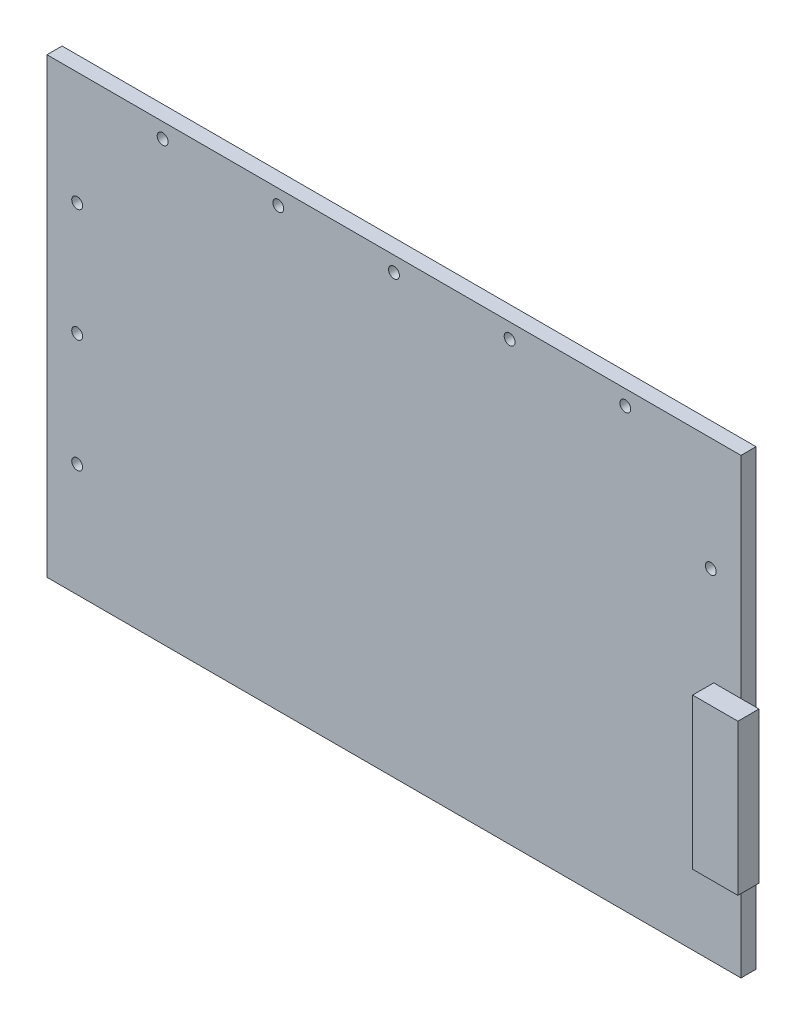
from build123d import *

# Parameters (mm, degrees)
SZKIC1_W                                          = 230
SZKIC1_H                                          = 150
DODANIE_WYCI_GNI_CIE1_DEPTH                       = 5
POG_BIENIE_WALCOWE_POD_M3_RUB_Z_BEM_S_D           = 3.6
POG_BIENIE_WALCOWE_POD_M3_RUB_Z_BEM_S_DEPTH       = 6.7
POG_BIENIE_WALCOWE_POD_M3_RUB_Z_BEM_S_CBORE_D     = 7
POG_BIENIE_WALCOWE_POD_M3_RUB_Z_BEM_S_CBORE_DEPTH = 2.4
POG_BIENIE_WALCOWE_POD_M3_RUB_Z_BEM_S_TIP         = 1.081549114
POG_BIENIE_WALCOWE_POD_M3_RUB_Z_B_2_D             = 3.6
POG_BIENIE_WALCOWE_POD_M3_RUB_Z_B_2_DEPTH         = 6.7
POG_BIENIE_WALCOWE_POD_M3_RUB_Z_B_2_CBORE_D       = 7
POG_BIENIE_WALCOWE_POD_M3_RUB_Z_B_2_CBORE_DEPTH   = 2.4
POG_BIENIE_WALCOWE_POD_M3_RUB_Z_B_2_TIP           = 1.081549114
SZKIC7_W                                          = 15
SZKIC7_H                                          = 50
DODANIE_WYCI_GNI_CIE3_DEPTH                       = 7
OTWORY_USTALAJ_CE_4_0MM1_D                        = 4
OTWORY_USTALAJ_CE_4_0MM1_DEPTH                    = 6.7


with BuildPart() as part:
    # Szkic1 → Dodanie-wyciągnięcie1 (new body)
    with BuildSketch(Plane.XY):
        Rectangle(SZKIC1_W, SZKIC1_H)
    extrude(amount=DODANIE_WYCI_GNI_CIE1_DEPTH)

    # Pog_bienie walcowe pod M3 _rub_ z _bem s
    with Locations(Plane(origin=(0, 0, 0), x_dir=(-1, 0, 0), z_dir=(0, 0, -1))):
        with Locations((105, 37.5), (105, 0), (105, -37.5), (-105, 0), (-105, 37.5)):
            CounterBoreHole(POG_BIENIE_WALCOWE_POD_M3_RUB_Z_BEM_S_D / 2, POG_BIENIE_WALCOWE_POD_M3_RUB_Z_BEM_S_CBORE_D / 2, POG_BIENIE_WALCOWE_POD_M3_RUB_Z_BEM_S_CBORE_DEPTH, depth=POG_BIENIE_WALCOWE_POD_M3_RUB_Z_BEM_S_DEPTH)
            with Locations((0, 0, -(POG_BIENIE_WALCOWE_POD_M3_RUB_Z_BEM_S_DEPTH + POG_BIENIE_WALCOWE_POD_M3_RUB_Z_BEM_S_TIP / 2))):  # 118° drill point
                Cone(0, POG_BIENIE_WALCOWE_POD_M3_RUB_Z_BEM_S_D / 2, POG_BIENIE_WALCOWE_POD_M3_RUB_Z_BEM_S_TIP, mode=Mode.SUBTRACT)

    # Pog_bienie walcowe pod M3 _rub_ z _b 2
    with Locations(Plane(origin=(0, 0, 0), x_dir=(-1, 0, 0), z_dir=(0, 0, -1))):
        with Locations((-76.666666667, 70), (-38.333333337, 70), (-7e-09, 70), (38.333333323, 70), (76.666666653, 70)):
            CounterBoreHole(POG_BIENIE_WALCOWE_POD_M3_RUB_Z_B_2_D / 2, POG_BIENIE_WALCOWE_POD_M3_RUB_Z_B_2_CBORE_D / 2, POG_BIENIE_WALCOWE_POD_M3_RUB_Z_B_2_CBORE_DEPTH, depth=POG_BIENIE_WALCOWE_POD_M3_RUB_Z_B_2_DEPTH)
            with Locations((0, 0, -(POG_BIENIE_WALCOWE_POD_M3_RUB_Z_B_2_DEPTH + POG_BIENIE_WALCOWE_POD_M3_RUB_Z_B_2_TIP / 2))):  # 118° drill point
                Cone(0, POG_BIENIE_WALCOWE_POD_M3_RUB_Z_B_2_D / 2, POG_BIENIE_WALCOWE_POD_M3_RUB_Z_B_2_TIP, mode=Mode.SUBTRACT)

    # Szkic7 → Dodanie-wyciągnięcie3 (add)
    with BuildSketch(Plane.XY.offset(5)):
        with Locations((113.480483413, -19.801368005)):
            Rectangle(SZKIC7_W, SZKIC7_H)
    extrude(amount=DODANIE_WYCI_GNI_CIE3_DEPTH)

    # Otwory ustalające Ø4.0mm1
    with Locations(Plane.XZ.offset(44.801368005)):
        with Locations((107.990241707, 8.5)):
            Hole(OTWORY_USTALAJ_CE_4_0MM1_D / 2, depth=OTWORY_USTALAJ_CE_4_0MM1_DEPTH)


solid = part.part
